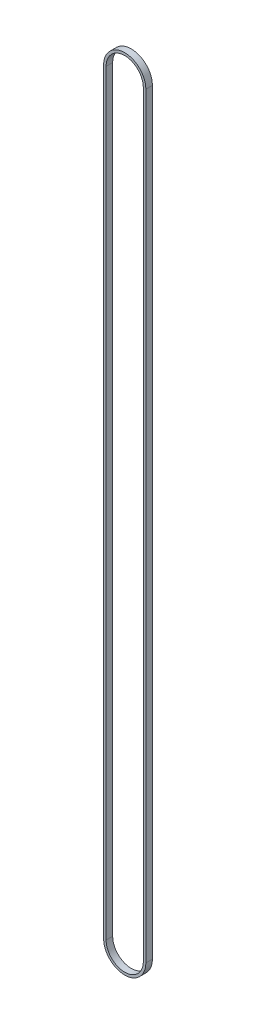
from build123d import *

# Parameters (mm, degrees)
BOSS_EXTRUDE1_DEPTH = 3.8989


with BuildPart() as part:
    # Sketch1 → Boss-Extrude1 (new, symmetric)
    with BuildSketch(Plane.XY):
        with BuildLine():
            Line((-25.1587, 901.7), (-25.1587, 0))
            ThreePointArc((-25.1587, 0), (0, -25.1587), (25.1587, 0))
            Line((25.1587, 0), (25.1587, 901.7))
            ThreePointArc((25.1587, 901.7), (0, 926.8587), (-25.1587, 901.7))
        make_face()
        with BuildLine():
            Line((22.1615, 0), (22.1615, 901.7))
            ThreePointArc((22.1615, 901.7), (0, 923.8615), (-22.1615, 901.7))
            Line((-22.1615, 901.7), (-22.1615, 0))
            ThreePointArc((-22.1615, 0), (0, -22.1615), (22.1615, 0))
        make_face(mode=Mode.SUBTRACT)
    extrude(amount=BOSS_EXTRUDE1_DEPTH, both=True)


solid = part.part
